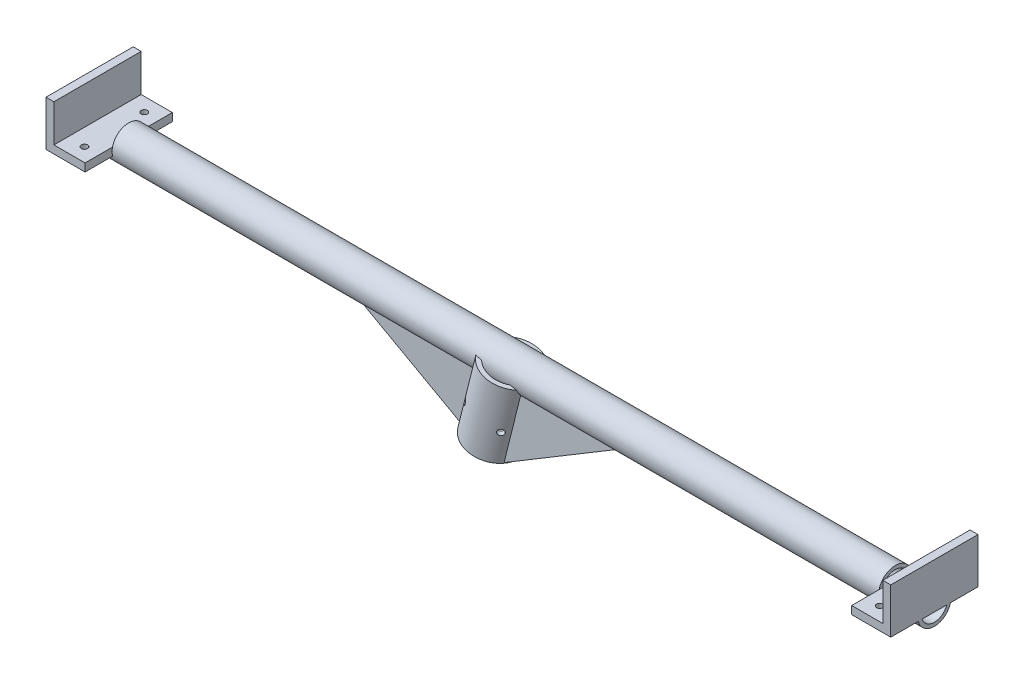
from build123d import *

# Parameters (mm, degrees)
SKETCH1_R                                = 13.335
SKETCH1_R_2                              = 10.465
BOSS_EXTRUDE1_DEPTH                      = 338.85
CUT_EXTRUDE3_START                       = -31.35
CUT_EXTRUDE3_DEPTH                       = 25
SKETCH5_W                                = 25
SKETCH5_H                                = 70
BOSS_EXTRUDE2_DEPTH                      = 6.35
BOSS_EXTRUDE3_START                      = -6.35
SKETCH6_W                                = 6.35
SKETCH6_H                                = 70
BOSS_EXTRUDE3_DEPTH                      = 36.35
F_8_0_199_DIAMETER_HOLE1_D               = 5.0546
F_8_0_199_DIAMETER_HOLE1_DEPTH           = 32.41
SKETCH10_R                               = 21.082
SKETCH10_R_2                             = 17.52
BOSS_EXTRUDE4_DEPTH                      = 60
F_8_0_199_DIAMETER_HOLE2_D               = 5.0546
F_8_0_199_DIAMETER_HOLE2_DEPTH           = 50
F_8_0_199_DIAMETER_HOLE2_ON_FACE_2_D     = 5.0546
F_8_0_199_DIAMETER_HOLE2_ON_FACE_2_DEPTH = 50
RIB3_REACH                               = 348.487
SKETCH17_WALL_W                          = 786.19696888
SKETCH17_WALL_H                          = 20
RIB4_REACH                               = 348.487
SKETCH18_WALL_W                          = 771.028594524
SKETCH18_WALL_H                          = 20


with BuildPart() as part:
    # Sketch1 → Boss-Extrude1 (new body)
    with BuildSketch(Plane(origin=(0, 0, 0), x_dir=(0, 0, -1), z_dir=(1, 0, 0))):
        Circle(SKETCH1_R)
        Circle(SKETCH1_R_2, mode=Mode.SUBTRACT)
    boss_extrude1 = extrude(amount=BOSS_EXTRUDE1_DEPTH)

    # Sketch4 → Cut-Extrude3 (cut)
    with BuildSketch(Plane(origin=(338.85, 0, 0), x_dir=(0, 0, -1), z_dir=(1, 0, 0)).offset(CUT_EXTRUDE3_START)):
        with BuildLine():
            Line((-12.993160701, 3), (12.993160701, 3))
            ThreePointArc((12.993160701, 3), (0, 13.335), (-12.993160701, 3))
        make_face()
    cut_extrude3 = extrude(amount=CUT_EXTRUDE3_DEPTH, mode=Mode.SUBTRACT)

    # Sketch5 → Boss-Extrude2 (add)
    with BuildSketch(Plane(origin=(0, 3, 0), x_dir=(1, 0, 0), z_dir=(0, 1, 0))):
        with Locations((320, -1e-09)):
            Rectangle(SKETCH5_W, SKETCH5_H)
    boss_extrude2 = extrude(amount=-BOSS_EXTRUDE2_DEPTH)

    # Sketch6 → Boss-Extrude3 (add)
    with BuildSketch(Plane(origin=(0, 3, 0), x_dir=(1, 0, 0), z_dir=(0, 1, 0)).offset(BOSS_EXTRUDE3_START)):
        with Locations((335.675, -1e-09)):
            Rectangle(SKETCH6_W, SKETCH6_H)
    boss_extrude3 = extrude(amount=BOSS_EXTRUDE3_DEPTH)

    # #8 (0.199) Diameter Hole1
    with Locations(Plane(origin=(0, -3.35, 0), x_dir=(-1, 0, 0), z_dir=(0, -1, 0))):
        with Locations((-319, 24), (-319, -24)):
            f_8_0_199_diameter_hole1 = Hole(F_8_0_199_DIAMETER_HOLE1_D / 2, depth=F_8_0_199_DIAMETER_HOLE1_DEPTH)

    # Mirror1: Boss-Extrude1, Cut-Extrude3, Boss-Extrude2, Boss-Extrude3, #8 (0.199) Diameter Hole1 across plane
    add(boss_extrude1.mirror(Plane(origin=(0, 0, 0), x_dir=(0, 0, 1), z_dir=(1, 0, 0))))
    add(cut_extrude3.mirror(Plane(origin=(0, 0, 0), x_dir=(0, 0, 1), z_dir=(1, 0, 0))), mode=Mode.SUBTRACT)
    add(boss_extrude2.mirror(Plane(origin=(0, 0, 0), x_dir=(0, 0, 1), z_dir=(1, 0, 0))))
    add(boss_extrude3.mirror(Plane(origin=(0, 0, 0), x_dir=(0, 0, 1), z_dir=(1, 0, 0))))
    add(f_8_0_199_diameter_hole1.mirror(Plane(origin=(0, 0, 0), x_dir=(0, 0, 1), z_dir=(1, 0, 0))), mode=Mode.SUBTRACT)

    # Sketch10 → Boss-Extrude4 (add)
    with BuildSketch(Plane(origin=(0, 0, 0), x_dir=(0.9702957262759956, -0.24192189559967145, 0), z_dir=(0.24192189559967145, 0.9702957262759956, 0))):
        Circle(SKETCH10_R)
        Circle(SKETCH10_R_2, mode=Mode.SUBTRACT)
    extrude(amount=-BOSS_EXTRUDE4_DEPTH)

    # #8 (0.199) Diameter Hole2
    with Locations(Plane(origin=(-22.93168321, -30.353966251, 14.907225161), x_dir=(0.717685601487, 0, 0.696367271932), z_dir=(-0.686102687806, 0.171064612896, 0.707106781187))):
        with Locations((0, 0)):
            Hole(F_8_0_199_DIAMETER_HOLE2_D / 2, depth=F_8_0_199_DIAMETER_HOLE2_DEPTH)

    # #8 (0.199) Diameter Hole2 on face 2
    with Locations(Plane(origin=(5.997150518, -37.566734589, 14.907225161), x_dir=(0.717685550823, 0, -0.696367324148), z_dir=(0.686102701448, -0.171064925563, 0.707106692309))):
        with Locations((0, 0)):
            Hole(F_8_0_199_DIAMETER_HOLE2_ON_FACE_2_D / 2, depth=F_8_0_199_DIAMETER_HOLE2_ON_FACE_2_DEPTH)

    # Sketch17 wall → Rib3 (add, up to next)
    with BuildSketch(Plane(origin=(45.784817121, -36.82647049, 0), x_dir=(-0.857167300701, -0.515038074912, 0), z_dir=(0.515038074912, -0.857167300701, 0)), mode=Mode.PRIVATE) as rib3_sk1:
        Rectangle(SKETCH17_WALL_W, SKETCH17_WALL_H)
    rib3_tool1 = extrude(rib3_sk1.sketch, amount=-RIB3_REACH, mode=Mode.PRIVATE) - part.part
    add(rib3_tool1.solids().sort_by_distance((45.784817121, -36.82647049, 0))[0])

    # Sketch18 wall → Rib4 (add, up to next)
    with BuildSketch(Plane(origin=(-67.504439372, -31.770829497, 0), x_dir=(0.874619707136, -0.484809620252, 0), z_dir=(0.484809620252, 0.874619707136, 0)), mode=Mode.PRIVATE) as rib4_sk1:
        Rectangle(SKETCH18_WALL_W, SKETCH18_WALL_H)
    rib4_tool1 = extrude(rib4_sk1.sketch, amount=RIB4_REACH, mode=Mode.PRIVATE) - part.part
    add(rib4_tool1.solids().sort_by_distance((-67.504439372, -31.770829497, 0))[0])


solid = part.part
